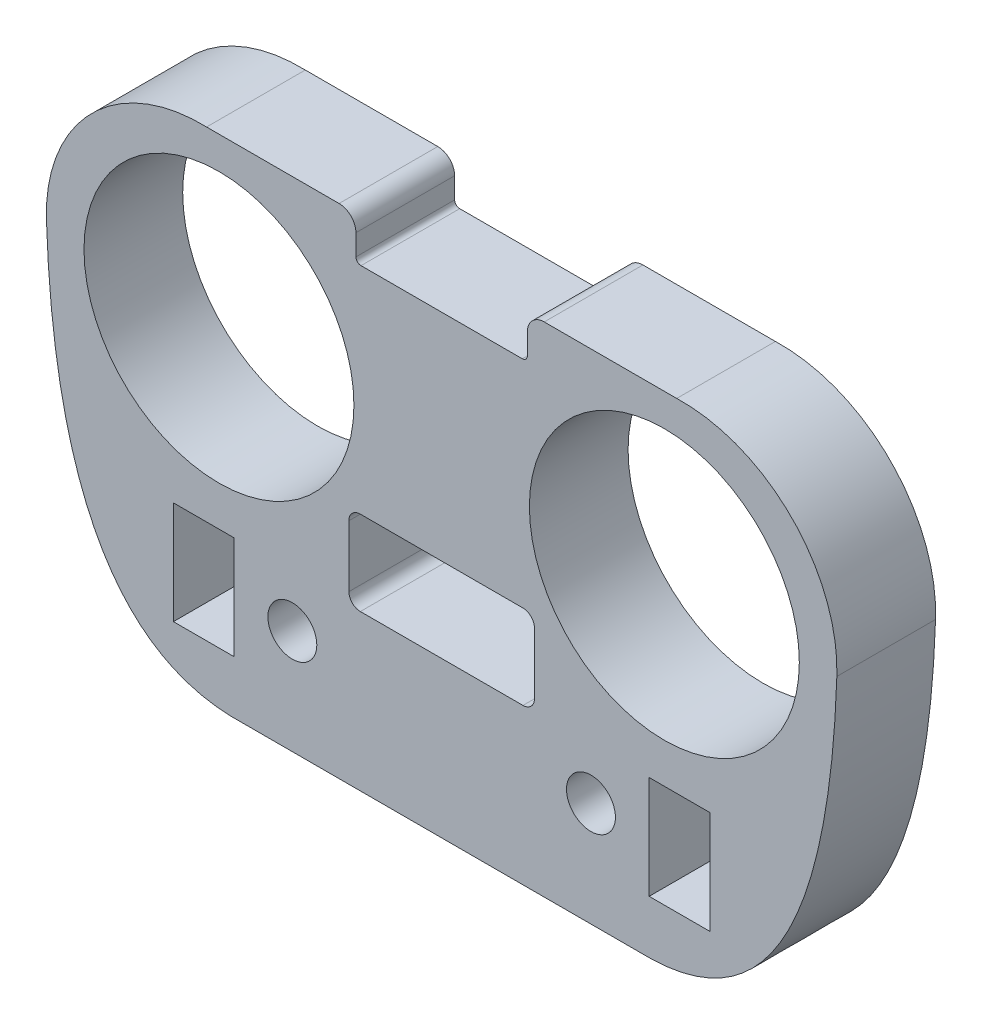
from build123d import *

# Parameters (mm, degrees)
MODEL_W             = 3.6
MODEL_H             = 6.1
MODEL_R             = 1.45
MODEL_R_2           = 8
BOSS_EXTRUDE1_DEPTH = 5.85
FILLET1_R           = 0.3
FILLET2_R           = 1


with BuildPart() as part:
    # Model → Boss-Extrude1 (new body)
    with BuildSketch(Plane.XY):
        with BuildLine():
            Line((549.596103149, 594.649674665), (540.7427075, 594.649674665))
            ThreePointArc((540.7427075, 594.649674665), (533.932980762, 591.943953999), (531.251426748, 585.124674665))
            add(Edge.make_bspline(
                [(531.251426748, 585.124674665), (531.926909632, 565.444526899), (542.192175731, 565.124674665)],
                knots=[0, 0, 0, 1, 1, 1], degree=2))
            Line((542.192175731, 565.124674665), (567.160030567, 565.124674665))
            add(Edge.make_bspline(
                [(578.10077955, 585.124674665), (577.425296665, 565.444526899), (567.160030567, 565.124674665)],
                knots=[0, 0, 0, 1, 1, 1], degree=2))
            ThreePointArc((578.10077955, 585.124674665), (575.419225536, 591.943953999), (568.609498798, 594.649674665))
            Line((568.609498798, 594.649674665), (559.756103149, 594.649674665))
            Line((559.756103149, 594.649674665), (559.756103149, 592.109674665))
            Line((559.756103149, 592.109674665), (549.596103149, 592.109674665))
            Line((549.596103149, 592.109674665), (549.596103149, 594.649674665))
        make_face()
        with Locations((540.576103149, 571.324674665)):
            Rectangle(MODEL_W, MODEL_H, mode=Mode.SUBTRACT)
        with Locations((545.826103149, 571.324674665)):
            Circle(MODEL_R, mode=Mode.SUBTRACT)
        with Locations((563.526103149, 571.324674665)):
            Circle(MODEL_R, mode=Mode.SUBTRACT)
        with Locations((568.776103149, 571.324674665)):
            Rectangle(MODEL_W, MODEL_H, mode=Mode.SUBTRACT)
        with BuildLine():
            Line((554.676103149, 574.334674665), (549.856103149, 574.334674665))
            ThreePointArc((549.856103149, 574.334674665), (549.375270538, 574.533842054), (549.176103149, 575.014674665))
            Line((549.176103149, 575.014674665), (549.176103149, 578.654674665))
            ThreePointArc((549.176103149, 578.654674665), (549.375270538, 579.135507276), (549.856103149, 579.334674665))
            Line((549.856103149, 579.334674665), (554.676103149, 579.334674665))
            Line((554.676103149, 579.334674665), (559.496103149, 579.334674665))
            ThreePointArc((559.496103149, 579.334674665), (559.97693576, 579.135507276), (560.176103149, 578.654674665))
            Line((560.176103149, 578.654674665), (560.176103149, 575.014674665))
            ThreePointArc((560.176103149, 575.014674665), (559.97693576, 574.533842054), (559.496103149, 574.334674665))
            Line((559.496103149, 574.334674665), (554.676103149, 574.334674665))
        make_face(mode=Mode.SUBTRACT)
        with Locations((541.476103149, 584.734674665)):
            Circle(MODEL_R_2, mode=Mode.SUBTRACT)
        with Locations((567.876103149, 584.734674665)):
            Circle(MODEL_R_2, mode=Mode.SUBTRACT)
    extrude(amount=BOSS_EXTRUDE1_DEPTH)

    # Fillet1
    fillet1_edges = [part.edges().sort_by_distance(p)[0] for p in [
        (559.756103149, 592.109674665, 2.925),
        (549.596103149, 592.109674665, 2.925),
    ]]
    fillet(fillet1_edges, radius=FILLET1_R)

    # Fillet2
    fillet2_edges = [part.edges().sort_by_distance(p)[0] for p in [
        (559.756103149, 594.649674665, 2.925),
        (549.596103149, 594.649674665, 2.925),
    ]]
    fillet(fillet2_edges, radius=FILLET2_R)


solid = part.part
